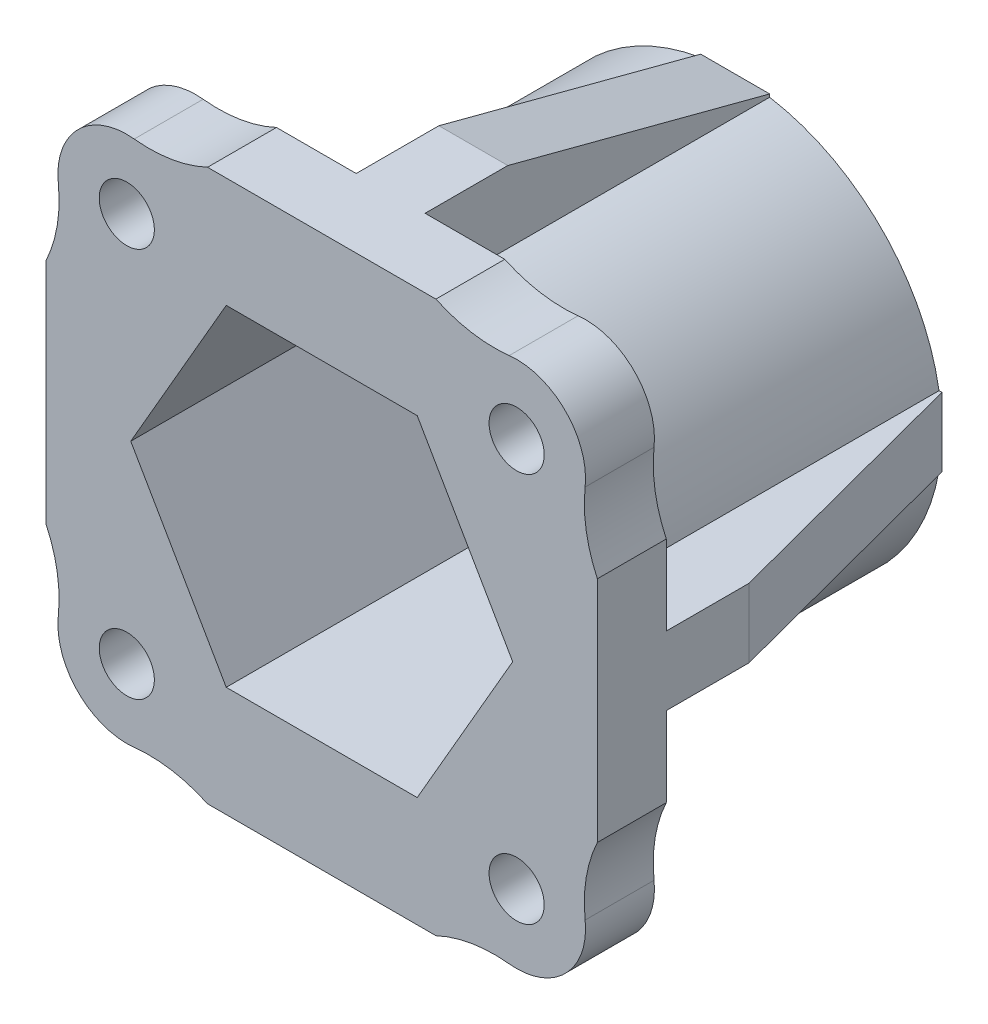
from build123d import *

# Parameters (mm, degrees)
SKETCH_1_R                      = 15
EXTRUDE_1_DEPTH                 = 30
EXTRUDE_3_DEPTH                 = 5
SKETCH_6_W                      = 5
SKETCH_6_H                      = 30
EXTRUDE_4_DEPTH                 = 30
RIB_START                       = -2.5
RIB_3_DEPTH                     = 5
PATTERN_CIRCULAR_1_COUNT        = 2
PATTERN_CIRCULAR_1_ANGLE        = 90
PATTERN_START                   = -2.5
PATTERN_CIRCULAR_1_COPY_1_DEPTH = 5
CUT_EXTRUDE_1_DEPTH             = 25
SKETCH_9_R                      = 8.5
CUT_EXTRUDE_3_DEPTH             = 42.231056256
EXTRUDE_START                   = 25
SKETCH_10_R                     = 5
SKETCH_10_R_2                   = 2
EXTRUDE_5_DEPTH                 = 5
SKETCH_10_2_R                   = 2
CUT_EXTRUDE_4_DEPTH             = 42.231056256
FILLET_1_R                      = 10


# Read off the part's stored shape, not the designer's step: 筋3
with BuildPart() as part:
    # 草图1 → 凸台-拉伸1 (new body)
    with BuildSketch(Plane.XY):
        Circle(SKETCH_1_R)
    extrude(amount=EXTRUDE_1_DEPTH)

    # 草图3 → 凸台-拉伸3 (add)
    with BuildSketch(Plane.XY.offset(30)):
        Polygon((20, -8.284271247), (20, 8.284271247), (8.284271247, 20), (-8.284271247, 20), (-20, 8.284271247), (-20, -8.284271247), (-8.284271247, -20), (8.284271247, -20), align=None)
    extrude(amount=-EXTRUDE_3_DEPTH)

    # 草图6 → 凸台-拉伸4 (add, through all)
    with BuildSketch(Plane.XY):
        Rectangle(SKETCH_6_W, SKETCH_6_H)
    extrude_4 = extrude(amount=EXTRUDE_4_DEPTH)

    # 筋3 outline → 筋3 (add)
    with BuildSketch(Plane(origin=(0, 0, 0), x_dir=(0, 0, -1), z_dir=(1, 0, 0)).offset(RIB_START)):
        Polygon((0, 15), (-19, 20), (-25, 20), (-25, 15), align=None)
    rib_3 = extrude(amount=RIB_3_DEPTH)

    # 镜向1: 筋3 across plane
    add(rib_3.mirror(Plane.ZX))

    # 阵列(圆周)1: 凸台-拉伸4, 筋3 ×2 about axis
    pattern_circular_1_axis = Axis((0, 0, 0), (0, 0, 1))
    add([extrude_4.rotate(pattern_circular_1_axis, i * PATTERN_CIRCULAR_1_ANGLE / (PATTERN_CIRCULAR_1_COUNT - 1)) for i in range(1, PATTERN_CIRCULAR_1_COUNT)])
    add([rib_3.rotate(pattern_circular_1_axis, i * PATTERN_CIRCULAR_1_ANGLE / (PATTERN_CIRCULAR_1_COUNT - 1)) for i in range(1, PATTERN_CIRCULAR_1_COUNT)])

    # 阵列(圆周)1 copy 1 sketch → 阵列(圆周)1 copy 1 (add)
    with BuildSketch(Plane(origin=(0, 0, 0), x_dir=(0, 0, -1), z_dir=(0, 1, 0)).offset(PATTERN_START)):
        Polygon((0, -15), (-19, -20), (-25, -20), (-25, -15), align=None)
    extrude(amount=PATTERN_CIRCULAR_1_COPY_1_DEPTH)

    # 草图8 → 切除-拉伸1 (cut)
    with BuildSketch(Plane.XY.offset(30)):
        Polygon((6.92820323, 12), (-6.92820323, 12), (-13.856406461, 0), (-6.92820323, -12), (6.92820323, -12), (13.856406461, 0), align=None)
    extrude(amount=-CUT_EXTRUDE_1_DEPTH, mode=Mode.SUBTRACT)

    # 草图9 → 切除-拉伸3 (cut, through all)
    with BuildSketch(Plane.XY):
        Circle(SKETCH_9_R)
    extrude(amount=CUT_EXTRUDE_3_DEPTH, mode=Mode.SUBTRACT)

    # 草图10 → 凸台-拉伸5 (add, through all)
    # profile 1 of 4: a face of its own
    with BuildSketch(Plane.XY.offset(EXTRUDE_START)):
        with Locations((14.142135624, 14.142135624)):
            Circle(SKETCH_10_R)
        with Locations((14.142135624, 14.142135624)):
            Circle(SKETCH_10_R_2, mode=Mode.SUBTRACT)
    # profile 2 of 4: a face of its own
    with BuildSketch(Plane.XY.offset(EXTRUDE_START)):
        with Locations((14.142135624, -14.142135624)):
            Circle(SKETCH_10_R)
        with Locations((14.142135624, -14.142135624)):
            Circle(SKETCH_10_R_2, mode=Mode.SUBTRACT)
    # profile 3 of 4: a face of its own
    with BuildSketch(Plane.XY.offset(EXTRUDE_START)):
        with Locations((-14.142135624, -14.142135624)):
            Circle(SKETCH_10_R)
        with Locations((-14.142135624, -14.142135624)):
            Circle(SKETCH_10_R_2, mode=Mode.SUBTRACT)
    # profile 4 of 4: a face of its own
    with BuildSketch(Plane.XY.offset(EXTRUDE_START)):
        with Locations((-14.142135624, 14.142135624)):
            Circle(SKETCH_10_R)
        with Locations((-14.142135624, 14.142135624)):
            Circle(SKETCH_10_R_2, mode=Mode.SUBTRACT)
    extrude(amount=EXTRUDE_5_DEPTH)

    # 草图10<2> → 切除-拉伸4 (cut, through all)
    with BuildSketch(Plane.XY):
        with Locations((-14.142135624, 14.142135624)):
            Circle(SKETCH_10_2_R)
        with Locations((14.142135624, 14.142135624)):
            Circle(SKETCH_10_2_R)
        with Locations((14.142135624, -14.142135624)):
            Circle(SKETCH_10_2_R)
        with Locations((-14.142135624, -14.142135624)):
            Circle(SKETCH_10_2_R)
    extrude(amount=CUT_EXTRUDE_4_DEPTH, mode=Mode.SUBTRACT)

    # 圆角1
    # the kernel refuses this fillet: 10 mm, written as the material it adds along each edge
    with BuildSketch(Plane(origin=(10.606601718, -17.67766953, 30), x_dir=(0.9019133199255954, -0.4319170792418269, 0), z_dir=(0, 0, -1)), Plane(origin=(17.67766953, 10.606601718, 30), x_dir=(0.43191707924182504, 0.9019133199255963, 0), z_dir=(0, 0, -1)), Plane(origin=(-10.606601718, 17.67766953, 30), x_dir=(-0.9019133199255949, 0.4319170792418281, 0), z_dir=(0, 0, -1)), Plane(origin=(-17.67766953, -10.606601718, 30), x_dir=(-0.43191707924182854, -0.9019133199255946, 0), z_dir=(0, 0, -1))) as fillet_1_piece_1:
        with BuildLine():
            CenterArc((6.646750578, 9.431605202), FILLET_1_R, 219.30149192, 31.287792541)
            Line((-1.091486591, 3.097594978), (-1.246251334, 2.970914774))
            ThreePointArc((-1.246251334, 2.970914774), (-0.734375399, 1.482329983), (-0.188632104, -0.066467506))
            Line((-0.188632104, -0.066467506), (0.066467506, -0.188632104))
            ThreePointArc((0.066467506, -0.188632104), (1.661687645, 0.084197399), (3.256907783, -0.188632104))
            Line((3.256907783, -0.188632104), (3.323375289, 0))
        make_face()
    extrude(amount=5)
    with BuildSketch(Plane(origin=(17.67766953, -10.606601718, 30), x_dir=(0.4319170792418248, -0.9019133199255964, 0), z_dir=(0, 0, -1))) as fillet_1_piece_2:
        with BuildLine():
            CenterArc((6.646750578, -9.431605202), FILLET_1_R, 109.410715538, 31.287792541)
            Line((-1.091486591, -3.097594978), (-1.246251334, -2.970914774))
            ThreePointArc((-1.246251334, -2.970914774), (-0.734375399, -1.482329983), (-0.188632104, 0.066467506))
            Line((-0.188632104, 0.066467506), (0.066467506, 0.188632104))
            ThreePointArc((0.066467506, 0.188632104), (1.661687645, -0.084197399), (3.256907783, 0.188632104))
            Line((3.256907783, 0.188632104), (3.323375289, 0))
        make_face()
    extrude(amount=5)
    with BuildSketch(Plane(origin=(10.606601718, 17.67766953, 30), x_dir=(-0.7071067811865472, 0.7071067811865478, 0), z_dir=(0, 0, -1)), Plane(origin=(-17.67766953, 10.606601718, 30), x_dir=(-0.7071067811865486, -0.7071067811865465, 0), z_dir=(0, 0, -1)), Plane(origin=(-10.606601718, -17.67766953, 30), x_dir=(0.7071067811865476, -0.7071067811865476, 0), z_dir=(0, 0, -1))) as fillet_1_piece_3:
        with BuildLine():
            CenterArc((6.686553006, 9.4034291), FILLET_1_R, 218.821431077, 31.287792541)
            Line((-1.104482331, 3.134476367), (-1.260303038, 3.009097312))
            ThreePointArc((-1.260303038, 3.009097312), (-0.472829503, 1.595220139), (-0.2, 0))
            Line((-0.2, 0), (0, -0.2))
            ThreePointArc((0, -0.2), (1.642135624, -0.2), (3.216225612, -0.188068582))
            Line((3.216225612, -0.188068582), (3.284271247, 0))
        make_face()
    extrude(amount=5)


solid = part.part
